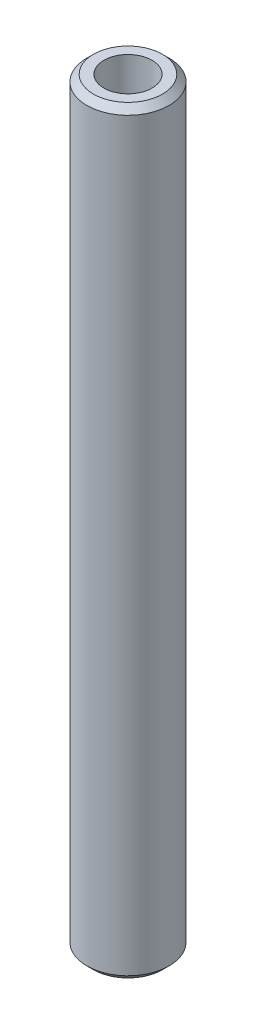
from build123d import *

# Parameters (mm, degrees)
SKETCH1_R           = 15
BOSS_EXTRUDE1_DEPTH = 276.816888978
SKETCH2_R           = 8.800335209
CUT_EXTRUDE1_DEPTH  = 278.628510826
CHAMFER1_SIZE       = 2.39755807


with BuildPart() as part:
    # Sketch1 → Boss-Extrude1 (new body)
    with BuildSketch(Plane(origin=(0, 0, 0), x_dir=(1, 0, 0), z_dir=(0, 1, 0))):
        Circle(SKETCH1_R)
    extrude(amount=BOSS_EXTRUDE1_DEPTH)

    # Sketch2 → Cut-Extrude1 (cut, through all)
    with BuildSketch(Plane(origin=(0, 0, 0), x_dir=(1, 0, 0), z_dir=(0, 1, 0))):
        Circle(SKETCH2_R)
    extrude(amount=CUT_EXTRUDE1_DEPTH, mode=Mode.SUBTRACT)

    # Chamfer1
    chamfer1_edges = [part.edges().sort_by_distance(p)[0] for p in [
        (-15, 276.816888978, 0),
        (-15, 0, 0),
    ]]
    chamfer(chamfer1_edges, length=CHAMFER1_SIZE)


solid = part.part
